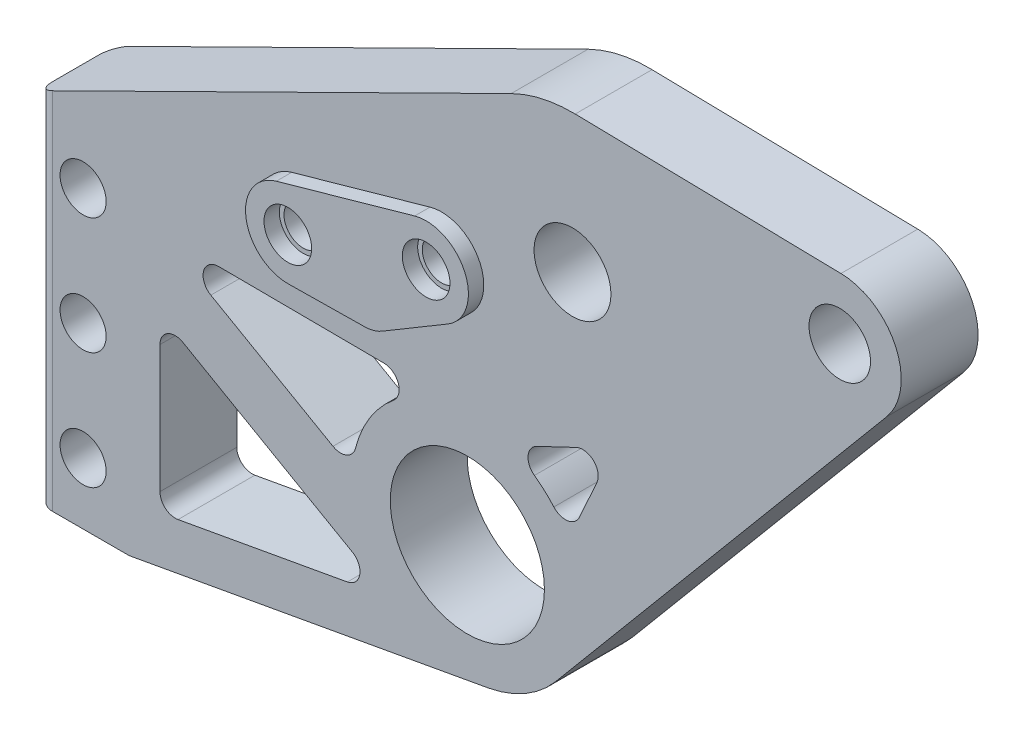
from build123d import *

# Parameters (mm, degrees)
SKETCH_1_R          = 1.5
SKETCH_1_R_2        = 5.015
SKETCH_1_R_3        = 2.5
SKETCH_1_R_4        = 1.515
SKETCH_1_R_5        = 1.25
EXTRUDE_1_DEPTH     = 5
FILLET_1_R          = 1
SKETCH_2_R          = 1.55
EXTRUDE_2_DEPTH     = 1
CUT_EXTRUDE_START   = -10
CUT_EXTRUDE_1_DEPTH = 10
FILLET_2_R          = 1
EXTRUDE_START       = -5
SKETCH_4_R          = 2
EXTRUDE_3_DEPTH     = 5


with BuildPart() as part:
    # 草图1 → 凸台-拉伸1 (new body)
    with BuildSketch(Plane.XY):
        with BuildLine():
            Line((0, 0), (0, 23.2))
            Line((0, 23.2), (30.849852826, 38.460791759))
            ThreePointArc((30.849852826, 38.460791759), (41.091229844, 36.86897111), (43.042953344, 26.6900482))
            Line((43.042953344, 26.6900482), (34.835458731, 8.513496487))
            ThreePointArc((34.835458731, 8.513496487), (32.614833027, 5.68786704), (29.3346121, 4.219701189))
            Line((29.3346121, 4.219701189), (6, 0))
            Line((6, 0), (0, 0))
        make_face()
        with Locations((3, 19.2)):
            Circle(SKETCH_1_R, mode=Mode.SUBTRACT)
        with Locations((3, 11.6)):
            Circle(SKETCH_1_R, mode=Mode.SUBTRACT)
        with Locations((3, 4)):
            Circle(SKETCH_1_R, mode=Mode.SUBTRACT)
        with Locations((28, 11.6)):
            Circle(SKETCH_1_R_2, mode=Mode.SUBTRACT)
        with Locations((34.840402867, 30.393852416)):
            Circle(SKETCH_1_R_3, mode=Mode.SUBTRACT)
        with Locations((22.298810634, 23.803988685)):
            Circle(SKETCH_1_R_4, mode=Mode.SUBTRACT)
        with Locations((17.318802705, 24.237631422)):
            Circle(SKETCH_1_R_5, mode=Mode.SUBTRACT)
        with Locations((26.317290694, 26.777260117)):
            Circle(SKETCH_1_R_5, mode=Mode.SUBTRACT)
    extrude(amount=EXTRUDE_1_DEPTH)

    # 圆角1
    fillet_1_edges = [part.edges().sort_by_distance(p)[0] for p in [
        (0, 11.6, 0),
        (0, 11.6, 5),
    ]]
    fillet(fillet_1_edges, radius=FILLET_1_R)

    # 草图3 → 切除-拉伸1 (cut)
    with BuildSketch(Plane.XY.offset(5).offset(CUT_EXTRUDE_START)):
        with BuildLine():
            Line((34.570478049, 15.216464877), (37.548117185, 21.810829453))
            Line((37.548117185, 21.810829453), (30.748975297, 18.578046633))
            ThreePointArc((30.748975297, 18.578046633), (32.953595729, 17.231331047), (34.570478049, 15.216464877))
        make_face()
        Polygon((8, 14.618103259), (8, 3.410325902), (22.896528211, 6.104131033), align=None)
        with BuildLine():
            Line((28.046942827, 19.09985309), (8, 19.225330237))
            Line((8, 19.225330237), (20.514901979, 12.072554345))
            ThreePointArc((20.514901979, 12.072554345), (22.883627253, 17.083860858), (28.046942827, 19.09985309))
        make_face()
    extrude(amount=CUT_EXTRUDE_1_DEPTH, mode=Mode.SUBTRACT)

    # 圆角2
    fillet_2_edges = [part.edges().sort_by_distance(p)[0] for p in [
        (22.896528211, 6.104131033, 2.5),
        (8, 3.410325902, 2.5),
        (30.748975297, 18.578046633, 2.5),
        (37.548117185, 21.810829453, 2.5),
        (34.570478049, 15.216464877, 2.5),
        (8, 14.618103259, 2.5),
        (20.514901979, 12.072554345, 2.5),
        (8, 19.225330237, 2.5),
    ]]
    fillet(fillet_2_edges, radius=FILLET_2_R)
    fillet_2_2_edges = [part.edges().sort_by_distance(p)[0] for p in [
        (28.046942827, 19.09985309, 2.5),
    ]]
    fillet(fillet_2_2_edges, radius=FILLET_2_R)

    # 草图4 → 凸台-拉伸3 (add)
    with BuildSketch(Plane.XY.offset(5).offset(EXTRUDE_START)):
        with BuildLine():
            Line((52.3057854, 39.051820594), (35.017517601, 39.39210949))
            ThreePointArc((35.017517601, 39.39210949), (42.448969585, 35.201108648), (43.042953344, 26.6900482))
            Line((43.042953344, 26.6900482), (34.835458731, 8.513496487))
            ThreePointArc((34.835458731, 8.513496487), (34.350844876, 7.610417396), (33.747636481, 6.781839056))
            Line((33.747636481, 6.781839056), (55.292473863, 32.482909391))
            ThreePointArc((55.292473863, 32.482909391), (55.868362453, 36.708183585), (52.3057854, 39.051820594))
        make_face()
        with Locations((52.22706774, 35.052595228)):
            Circle(SKETCH_4_R, mode=Mode.SUBTRACT)
    extrude(amount=EXTRUDE_3_DEPTH)


with BuildPart() as body_2:
    # 草图2 → 凸台-拉伸2 (new body)
    with BuildSketch(Plane.XY.offset(5)):
        with BuildLine():
            Line((16.571853089, 26.884245537), (25.570341078, 29.423874231))
            ThreePointArc((25.570341078, 29.423874231), (28.843923131, 27.862906713), (27.723099502, 24.413745446))
            Line((27.723099502, 24.413745446), (23.448431167, 21.871190298))
            ThreePointArc((23.448431167, 21.871190298), (22.909639512, 21.639681623), (22.329312241, 21.555343175))
            Line((22.329312241, 21.555343175), (17.356101471, 21.487884379))
            ThreePointArc((17.356101471, 21.487884379), (14.597391395, 23.842131129), (16.571853089, 26.884245537))
        make_face()
        with Locations((17.318802705, 24.237631422)):
            Circle(SKETCH_2_R, mode=Mode.SUBTRACT)
        with Locations((26.317290694, 26.777260117)):
            Circle(SKETCH_2_R, mode=Mode.SUBTRACT)
    extrude(amount=EXTRUDE_2_DEPTH)


solid = Compound([part.part, body_2.part])
